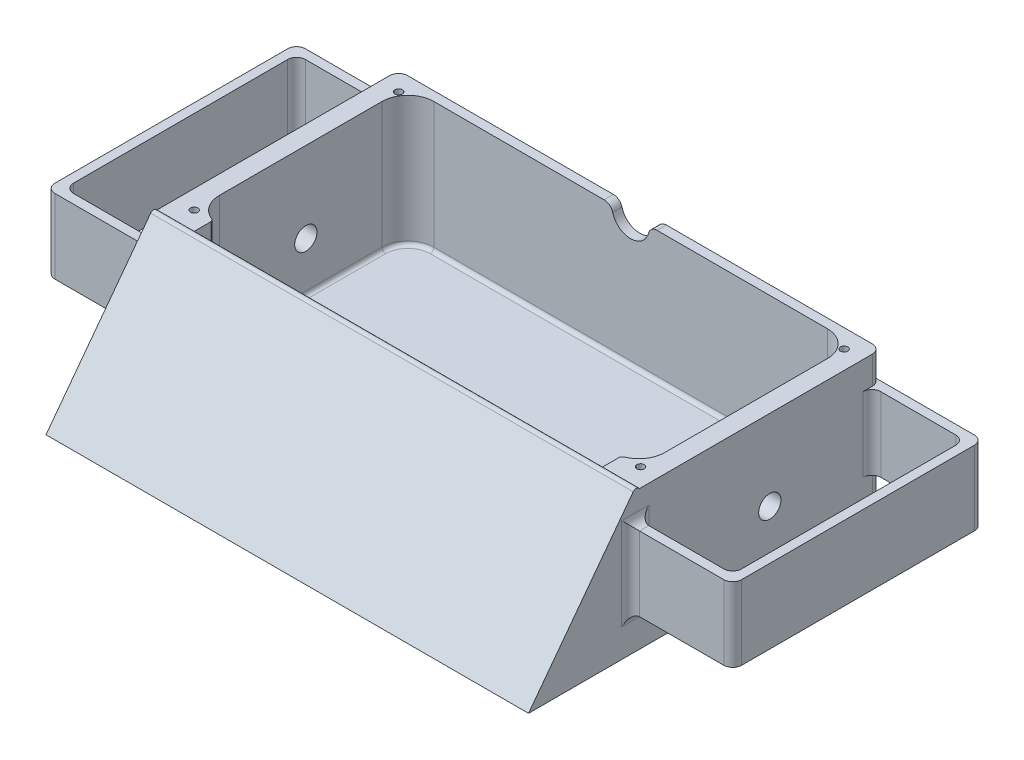
from build123d import *

# Parameters (mm, degrees)
SKETCH1_W               = 152.4
SKETCH1_H               = 76.2
BOSS_EXTRUDE1_DEPTH     = 50.8
SKETCH1_3_W             = 152.4
SKETCH1_3_H             = 76.2
BOSS_EXTRUDE2_DEPTH     = 3.175
SKETCH8_W               = 152.4
SKETCH8_H               = 47.625
CUT_EXTRUDE1_DEPTH      = 6.35
BOSS_EXTRUDE10_REACH    = 212.462
BOSS_EXTRUDE11_DEPTH    = 3.175
SKETCH12_W              = 34.925
SKETCH12_H              = 38.1
BOSS_EXTRUDE12_DEPTH    = 3.175
CUT_EXTRUDE2_DEPTH      = 153.300748931
CUT_EXTRUDE2_DEPTH_BACK = 153.300748931
SKETCH13_W              = 34.925
SKETCH13_H              = 12.7
SKETCH14_W              = 34.925
SKETCH14_H              = 85.725
CUT_EXTRUDE3_DEPTH      = 12.7
CUT_EXTRUDE4_DEPTH      = 6.096
CUT_EXTRUDE4_DEPTH_BACK = 173.99
SKETCH16_R              = 3.81
SKETCH17_W              = 165.1
SKETCH17_H              = 82.55
CUT_EXTRUDE5_DEPTH      = 3.175
SKETCH25_W              = 6.35
SKETCH25_H              = 6.35
BOSS_EXTRUDE16_DEPTH    = 44.45
FILLET2_R               = 8.89
FILLET3_R               = 1.27
CUT_EXTRUDE8_DEPTH      = 150.562384559
CUT_EXTRUDE8_DEPTH_BACK = 150.562384559
SKETCH26_R              = 1.27
FILLET4_R               = 3.048
CUT_EXTRUDE9_DEPTH      = 176.173701579
CUT_EXTRUDE9_DEPTH_BACK = 7.366
SKETCH27_R              = 6.35
FILLET5_R               = 3.048


with BuildPart() as part:
    # Sketch1 → Boss-Extrude1 (new body)
    with BuildSketch(Plane(origin=(0, 0, 0), x_dir=(1, 0, 0), z_dir=(0, 1, 0))):
        Polygon((-117.475, 41.275), (-117.475, -41.275), (-114.3, -41.275), (-114.3, 38.1), (-82.55, 38.1), (-82.55, -41.275), (82.55, -41.275), (82.55, 38.1), (114.3, 38.1), (114.3, -41.275), (117.475, -41.275), (117.475, 41.275), align=None)
        Rectangle(SKETCH1_W, SKETCH1_H, mode=Mode.SUBTRACT)
    extrude(amount=BOSS_EXTRUDE1_DEPTH)

    # Sketch1<3> → Boss-Extrude2 (add)
    with BuildSketch(Plane(origin=(0, 0, 0), x_dir=(1, 0, 0), z_dir=(0, 1, 0))):
        Rectangle(SKETCH1_3_W, SKETCH1_3_H)
    extrude(amount=BOSS_EXTRUDE2_DEPTH)

    # Sketch8 → Cut-Extrude1 (cut)
    with BuildSketch(Plane.XY.offset(41.275)):
        with Locations((0, 26.9875)):
            Rectangle(SKETCH8_W, SKETCH8_H)
    extrude(amount=-CUT_EXTRUDE1_DEPTH, mode=Mode.SUBTRACT)

    # Boss-Extrude10: up to this face of the body (flat: up to its plane)
    boss_extrude10_end = Plane(part.part.faces().sort_by_distance((82.55, 25.4, 1.5875))[0])
    # Sketch10 → Boss-Extrude10 (add, up to the picked face)
    with BuildSketch(Plane.ZY.offset(82.55), mode=Mode.PRIVATE) as boss_extrude10_sk1:
        Polygon((41.275, 50.8), (79.375, 0), (41.275, 0), (41.275, 3.175), (73.025, 3.175), (41.275, 45.508333333), align=None)
    boss_extrude10_tool1 = split(extrude(boss_extrude10_sk1.sketch, amount=-BOSS_EXTRUDE10_REACH, mode=Mode.PRIVATE), bisect_by=boss_extrude10_end, keep=Keep.BOTH, mode=Mode.PRIVATE)
    add(boss_extrude10_tool1.solids().sort_by(Axis((-82.55, 25.019, 59.817), (1, 0, 0)))[0])

    # Sketch11 → Boss-Extrude11 (add)
    with BuildSketch(Plane(origin=(82.55, 0, 0), x_dir=(0, 0, -1), z_dir=(1, 0, 0))):
        Polygon((-41.275, 45.508333333), (-73.025, 3.175), (-41.275, 3.175), align=None)
    boss_extrude11 = extrude(amount=-BOSS_EXTRUDE11_DEPTH)

    # Sketch12 → Boss-Extrude12 (add)
    with BuildSketch(Plane.XY.offset(41.275)):
        with Locations((100.0125, 19.05)):
            Rectangle(SKETCH12_W, SKETCH12_H)
    boss_extrude12 = extrude(amount=BOSS_EXTRUDE12_DEPTH)

    # Mirror2: Boss-Extrude11 across plane
    add(boss_extrude11.mirror(Plane(origin=(0, 0, 0), x_dir=(0, 0, 1), z_dir=(1, 0, 0))))

    # Mirror3: Boss-Extrude12 across plane
    add(boss_extrude12.mirror(Plane(origin=(0, 0, 0), x_dir=(0, 0, 1), z_dir=(1, 0, 0))))

    # Sketch13 → Cut-Extrude2 (cut, two sides: drawn at the far end of the back side and taken through both)
    with BuildSketch(Plane.XY.offset(41.275).offset(-CUT_EXTRUDE2_DEPTH_BACK)):
        with Locations((100.0125, 44.45)):
            Rectangle(SKETCH13_W, SKETCH13_H)
        with Locations((-100.0125, 44.45)):
            Rectangle(SKETCH13_W, SKETCH13_H)
    extrude(amount=CUT_EXTRUDE2_DEPTH + CUT_EXTRUDE2_DEPTH_BACK, mode=Mode.SUBTRACT)

    # Sketch14 → Cut-Extrude3 (cut)
    with BuildSketch(Plane(origin=(0, 0, 0), x_dir=(-1, 0, 0), z_dir=(0, -1, 0))):
        with Locations((-100.0125, -1.5875)):
            Rectangle(SKETCH14_W, SKETCH14_H)
    cut_extrude3 = extrude(amount=-CUT_EXTRUDE3_DEPTH, mode=Mode.SUBTRACT)

    # Mirror4: Cut-Extrude3 across plane
    add(cut_extrude3.mirror(Plane(origin=(0, 0, 0), x_dir=(0, 0, 1), z_dir=(1, 0, 0))), mode=Mode.SUBTRACT)

    # Sketch16 → Cut-Extrude4 (cut, two sides: drawn at the far end of the back side and taken through both)
    with BuildSketch(Plane.ZY.offset(82.55).offset(-CUT_EXTRUDE4_DEPTH_BACK)):
        with Locations(Location((-3.175, 20.066, 0), (0, 0, 180))):
            Circle(SKETCH16_R)
    extrude(amount=CUT_EXTRUDE4_DEPTH + CUT_EXTRUDE4_DEPTH_BACK, mode=Mode.SUBTRACT)

    # Sketch17 → Cut-Extrude5 (cut)
    with BuildSketch(Plane(origin=(0, 50.8, 0), x_dir=(1, 0, 0), z_dir=(0, 1, 0))):
        Rectangle(SKETCH17_W, SKETCH17_H)
    extrude(amount=-CUT_EXTRUDE5_DEPTH, mode=Mode.SUBTRACT)

    # Sketch25 → Boss-Extrude16 (add)
    with BuildSketch(Plane(origin=(0, 3.175, 0), x_dir=(1, 0, 0), z_dir=(0, 1, 0))):
        with Locations((73.025, -38.1)):
            Rectangle(SKETCH25_W, SKETCH25_H)
        with Locations((-73.025, -38.1)):
            Rectangle(SKETCH25_W, SKETCH25_H)
    extrude(amount=BOSS_EXTRUDE16_DEPTH)

    # Fillet2
    # the kernel refuses this fillet: 8.89 mm, written as the material it adds along each edge
    with BuildSketch(Plane(origin=(76.2, 3.175, 34.925), x_dir=(0, 0, -1), z_dir=(0, 1, 0))) as fillet2_piece_1:
        with BuildLine():
            CenterArc((8.519418994, 8.89), FILLET2_R, 196.601549599, 73.398450401)
            Line((0, 6.35), (-0.17038838, 6.2992))
            ThreePointArc((-0.17038838, 6.2992), (-0.1778, 3.175), (-0.1778, 0))
            Line((-0.1778, 0), (0, -0.1778))
            Line((0, -0.1778), (8.519418994, -0.1778))
            Line((8.519418994, -0.1778), (8.519418994, 0))
        make_face()
    extrude(amount=44.45)
    with BuildSketch(Plane(origin=(76.2, 3.175, -38.1), x_dir=(-1, 0, 0), z_dir=(0, 1, 0)), Plane(origin=(-76.2, 3.175, -38.1), x_dir=(0, 0, 1), z_dir=(0, 1, 0))) as fillet2_piece_2:
        with BuildLine():
            CenterArc((FILLET2_R, FILLET2_R), FILLET2_R, 180, 90)
            Line((0, FILLET2_R), (-FILLET2_R * 0.02, FILLET2_R))
            Line((-FILLET2_R * 0.02, FILLET2_R), (-FILLET2_R * 0.02, -FILLET2_R * 0.02))
            Line((-FILLET2_R * 0.02, -FILLET2_R * 0.02), (FILLET2_R, -FILLET2_R * 0.02))
            Line((FILLET2_R, -FILLET2_R * 0.02), (FILLET2_R, 0))
        make_face()
    extrude(amount=44.45)
    with BuildSketch(Plane(origin=(-76.2, 3.175, 34.925), x_dir=(1, 0, 0), z_dir=(0, 1, 0))) as fillet2_piece_3:
        with BuildLine():
            CenterArc((8.89, 8.519418994), FILLET2_R, 180, 73.398450401)
            Line((0, 8.519418994), (-0.1778, 8.519418994))
            Line((-0.1778, 8.519418994), (-0.1778, 0))
            Line((-0.1778, 0), (0, -0.1778))
            ThreePointArc((0, -0.1778), (3.175, -0.1778), (6.2992, -0.17038838))
            Line((6.2992, -0.17038838), (6.35, 0))
        make_face()
    extrude(amount=44.45)

    # Fillet3
    fillet3_edges = [part.edges().sort_by_distance(p)[0] for p in [
        (74.6125, 3.175, 41.275),
        (79.375, 3.175, 57.15),
        (0, 3.175, 73.025),
        (-79.375, 3.175, 57.15),
        (-74.6125, 3.175, 41.275),
        (-69.85, 3.175, 38.1),
        (-74.437857322, 3.175, 31.718372174),
        (-76.2, 3.175, -1.402209497),
        (-73.596179285, 3.175, -35.496179285),
        (0, 3.175, -38.1),
        (73.596179285, 3.175, -35.496179285),
        (76.2, 3.175, -1.402209497),
        (74.437857322, 3.175, 31.718372174),
        (69.85, 3.175, 38.1),
        (-69.85, 25.4, 34.925),
        (69.85, 25.4, 34.925),
        (0, 50.8, 41.275),
    ]]
    fillet(fillet3_edges, radius=FILLET3_R)

    # Sketch26 → Cut-Extrude8 (cut, two sides: drawn at the far end of the back side and taken through both)
    with BuildSketch(Plane(origin=(0, 47.625, 0), x_dir=(1, 0, 0), z_dir=(0, 1, 0)).offset(-CUT_EXTRUDE8_DEPTH_BACK)):
        with Locations(Location((-76.2, 34.925, 0), (0, 0, 270))):
            Circle(SKETCH26_R)
        with Locations(Location((76.2, 34.925, 0), (0, 0, 270))):
            Circle(SKETCH26_R)
        with Locations(Location((76.271823643, -34.767866531, 0), (0, 0, 270))):
            Circle(SKETCH26_R)
        with Locations(Location((-76.127852634, -35.081985097, 0), (0, 0, 270))):
            Circle(SKETCH26_R)
    extrude(amount=CUT_EXTRUDE8_DEPTH + CUT_EXTRUDE8_DEPTH_BACK, mode=Mode.SUBTRACT)

    # Fillet4
    fillet4_edges = [part.edges().sort_by_distance(p)[0] for p in [
        (-114.3, 25.4, 41.275),
        (-114.3, 25.4, -38.1),
        (-82.55, 25.4, -38.1),
        (-82.55, 25.4, 41.275),
        (82.55, 25.4, 41.275),
        (114.3, 25.4, 41.275),
        (114.3, 25.4, -38.1),
        (82.55, 25.4, -38.1),
        (82.55, 12.7, 42.8625),
        (-82.55, 12.7, 42.8625),
        (-82.55, 38.1, 42.8625),
        (82.55, 38.1, 42.8625),
        (117.475, 25.4, -41.275),
        (117.475, 25.4, 44.45),
        (82.55, 25.4, 44.45),
        (-117.475, 25.4, 44.45),
        (-82.55, 25.4, 44.45),
        (-117.475, 25.4, -41.275),
        (-82.55, 6.35, -41.275),
        (82.55, 6.35, -41.275),
        (82.55, 42.8625, -41.275),
        (-82.55, 42.8625, -41.275),
    ]]
    fillet(fillet4_edges, radius=FILLET4_R)

    # Sketch27 → Cut-Extrude9 (cut, two sides: drawn at the far end of the back side and taken through both)
    with BuildSketch(Plane(origin=(0, 0, -41.275), x_dir=(-1, 0, 0), z_dir=(0, 0, -1)).offset(-CUT_EXTRUDE9_DEPTH_BACK)):
        with Locations((0, 46.99)):
            Circle(SKETCH27_R)
    extrude(amount=CUT_EXTRUDE9_DEPTH + CUT_EXTRUDE9_DEPTH_BACK, mode=Mode.SUBTRACT)

    # Fillet5
    fillet5_edges = [part.edges().sort_by_distance(p)[0] for p in [
        (6.318170226, 47.625, -39.6875),
        (-6.318170226, 47.625, -39.6875),
    ]]
    fillet(fillet5_edges, radius=FILLET5_R)


solid = part.part
